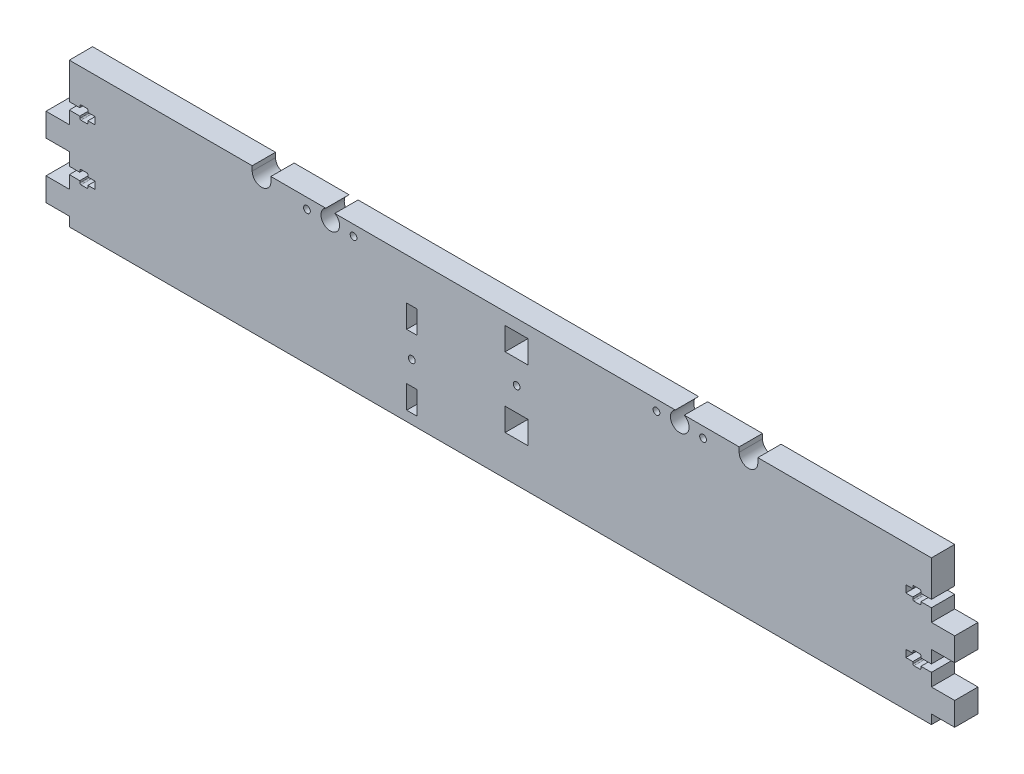
from build123d import *

# Parameters (mm, degrees)
MAINBODY_DEPTH      = 10
SCREWCUTOUTS_DEPTH  = 205.863369102
SKETCH2_R           = 4
SKETCH2_R_2         = 1.45
RODCUTOUTS_DEPTH    = 205.863369102
SKETCH4_R           = 1.45
SKETCH4_W           = 9.9
SKETCH4_H           = 9.8
CUT_EXTRUDE3_DEPTH  = 205.863369102
SKETCH5_R           = 1.45
SKETCH5_W           = 4.4
SKETCH5_H           = 9.8
SKETCH5_H_2         = 9.9
ENDSTOPHOLDER_DEPTH = 205.863369102
CUT_EXTRUDE4_DEPTH  = 205.863369102


with BuildPart() as part:
    # Sketch1 → MainBody (new body)
    with BuildSketch(Plane.XY):
        Polygon((0, 0), (-185, 0), (-185, -24), (-195, -24), (-195, -34), (-185, -34), (-185, -48), (-195, -48), (-195, -58), (-185, -58), (-185, -62), (0, -62), align=None)
    mainbody = extrude(amount=MAINBODY_DEPTH)

    # Sketch3 → ScrewCutouts (cut, through all)
    with BuildSketch(Plane.XY.offset(10)):
        with BuildLine():
            Line((-185, -18.55), (-180.5, -18.55))
            Line((-180.5, -18.55), (-180.5, -19.35))
            ThreePointArc((-180.5, -19.35), (-180.353553391, -19.703553391), (-180, -19.85))
            Line((-180, -19.85), (-177.5, -19.85))
            ThreePointArc((-177.5, -19.85), (-177.146446609, -19.703553391), (-177, -19.35))
            Line((-177, -19.35), (-177, -18.55))
            Line((-177, -18.55), (-174, -18.55))
            Line((-174, -18.55), (-174, -15.45))
            Line((-174, -15.45), (-177, -15.45))
            Line((-177, -15.45), (-177, -14.65))
            ThreePointArc((-177, -14.65), (-177.146446609, -14.296446609), (-177.5, -14.15))
            Line((-177.5, -14.15), (-180, -14.15))
            ThreePointArc((-180, -14.15), (-180.353553391, -14.296446609), (-180.5, -14.65))
            Line((-180.5, -14.65), (-180.5, -15.45))
            Line((-180.5, -15.45), (-185, -15.45))
            Line((-185, -15.45), (-185, -18.55))
        make_face()
        with BuildLine():
            Line((-185, -39.45), (-185, -42.55))
            Line((-185, -42.55), (-180.5, -42.55))
            Line((-180.5, -42.55), (-180.5, -43.35))
            ThreePointArc((-180.5, -43.35), (-180.353553391, -43.703553391), (-180, -43.85))
            Line((-180, -43.85), (-177.5, -43.85))
            ThreePointArc((-177.5, -43.85), (-177.146446609, -43.703553391), (-177, -43.35))
            Line((-177, -43.35), (-177, -42.55))
            Line((-177, -42.55), (-174, -42.55))
            Line((-174, -42.55), (-174, -39.45))
            Line((-174, -39.45), (-177, -39.45))
            Line((-177, -39.45), (-177, -38.65))
            ThreePointArc((-177, -38.65), (-177.146446609, -38.296446609), (-177.5, -38.15))
            Line((-177.5, -38.15), (-180, -38.15))
            ThreePointArc((-180, -38.15), (-180.353553391, -38.296446609), (-180.5, -38.65))
            Line((-180.5, -38.65), (-180.5, -39.45))
            Line((-180.5, -39.45), (-185, -39.45))
        make_face()
    screwcutouts = extrude(amount=-SCREWCUTOUTS_DEPTH, mode=Mode.SUBTRACT)

    # Mirror1: MainBody, ScrewCutouts across plane
    add(mainbody.mirror(Plane(origin=(0, 0, 0), x_dir=(0, 0, 1), z_dir=(1, 0, 0))))
    add(screwcutouts.mirror(Plane(origin=(0, 0, 0), x_dir=(0, 0, 1), z_dir=(1, 0, 0))), mode=Mode.SUBTRACT)

    # Sketch2 → RodCutouts (cut, through all)
    with BuildSketch(Plane.XY.offset(10)):
        with Locations((-73, -3.5)):
            Circle(SKETCH2_R)
        with Locations((-83, -4.5)):
            Circle(SKETCH2_R_2)
        with Locations((-63, -4.5)):
            Circle(SKETCH2_R_2)
        with Locations((67, -4.5)):
            Circle(SKETCH2_R_2)
        with Locations((87, -4.5)):
            Circle(SKETCH2_R_2)
        with Locations((77, -3.5)):
            Circle(SKETCH2_R)
    extrude(amount=-RODCUTOUTS_DEPTH, mode=Mode.SUBTRACT)

    # Sketch4 → Cut-Extrude3 (cut, through all)
    with BuildSketch(Plane.XY.offset(10)):
        with Locations((7, -25)):
            Circle(SKETCH4_R)
        with Locations((7, -10)):
            Rectangle(SKETCH4_W, SKETCH4_H)
        with Locations((7, -40)):
            Rectangle(SKETCH4_W, SKETCH4_H)
    extrude(amount=-CUT_EXTRUDE3_DEPTH, mode=Mode.SUBTRACT)

    # Sketch5 → EndstopHolder (cut, through all)
    with BuildSketch(Plane.XY.offset(10)):
        with Locations((-38, -37.75)):
            Circle(SKETCH5_R)
        with Locations((-38, -22.775)):
            Rectangle(SKETCH5_W, SKETCH5_H)
        with Locations((-38, -52.775)):
            Rectangle(SKETCH5_W, SKETCH5_H_2)
        with BuildLine():
            Line((-28.4, 8.994431211), (-28.4, 5))
            ThreePointArc((-28.4, 5), (-31.6, 1.8), (-34.8, 5))
            Line((-34.8, 5), (-34.8, 8.994431211))
            ThreePointArc((-34.8, 8.994431211), (-31.6, 12.194431211), (-28.4, 8.994431211))
        make_face()
    extrude(amount=-ENDSTOPHOLDER_DEPTH, mode=Mode.SUBTRACT)

    # Sketch7 → Cut-Extrude4 (cut, through all)
    with BuildSketch(Plane.XY.offset(10)):
        with BuildLine():
            Line((-98.5, 0), (-98.5, -2))
            ThreePointArc((-98.5, -2), (-102.5, -6), (-106.5, -2))
            Line((-106.5, -2), (-106.5, 0))
            ThreePointArc((-106.5, 0), (-102.5, 4), (-98.5, 0))
        make_face()
        with BuildLine():
            Line((102.5, 0), (102.5, -2))
            ThreePointArc((102.5, -2), (106.5, -6), (110.5, -2))
            Line((110.5, -2), (110.5, 0))
            ThreePointArc((110.5, 0), (106.5, 4), (102.5, 0))
        make_face()
    extrude(amount=-CUT_EXTRUDE4_DEPTH, mode=Mode.SUBTRACT)


solid = part.part
